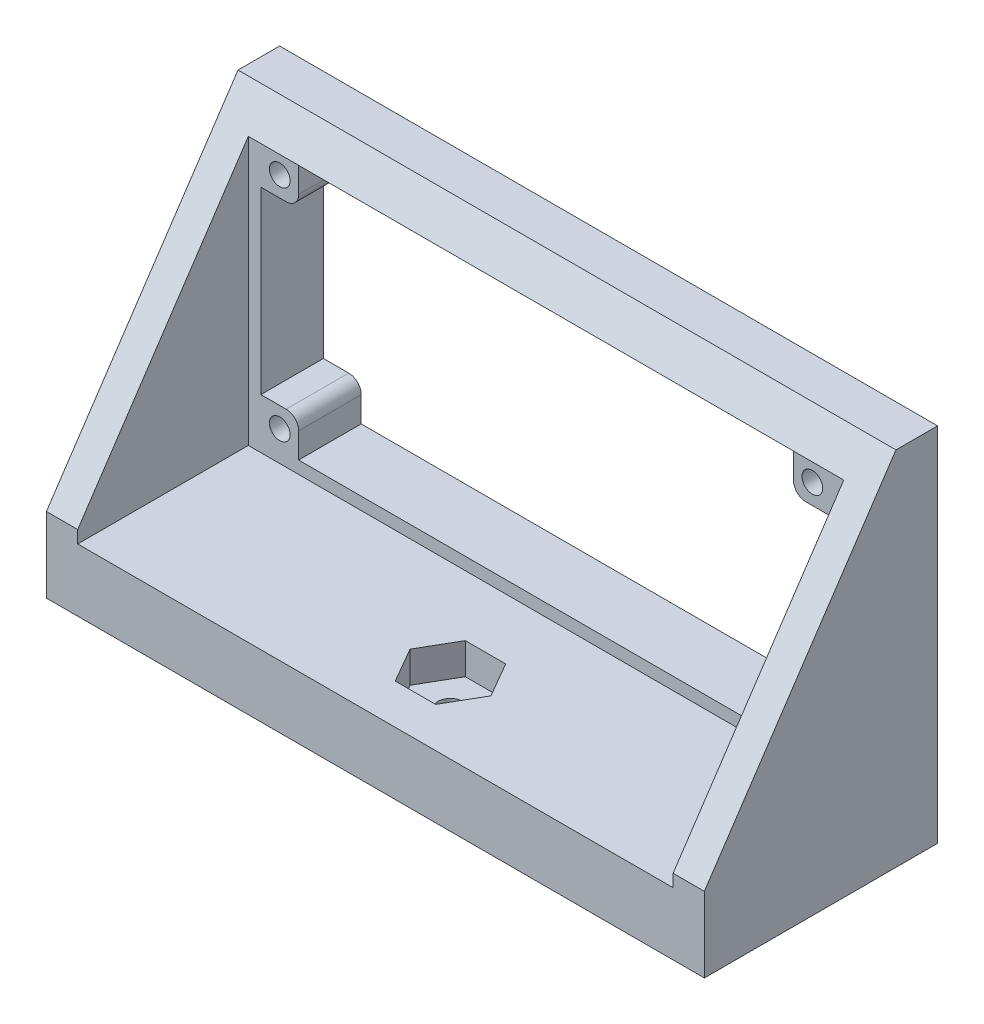
from build123d import *

# Parameters (mm, degrees)
ESQUISSE1_W             = 45.59
ESQUISSE1_H             = 20.4
ESQUISSE1_R             = 0.825
BOSS_EXTRU_1_DEPTH      = 5
ESQUISSE2_W             = 45.59
ESQUISSE2_H             = 18.64
BOSS_EXTRU_2_DEPTH      = 6
ESQUISSE3_R             = 1
ENL_V_MAT_EXTRU_1_DEPTH = 6
ENL_V_MAT_EXTRU_2_DEPTH = 3.5
ESQUISSE5_W             = 39.55
ESQUISSE5_H             = 20.4
ENL_V_MAT_EXTRU_3_DEPTH = 5
BOSS_EXTRU_3_DEPTH      = 3.5
BOSS_EXTRU_4_DEPTH      = 3.5
ESQUISSE8_W             = 45.59
ESQUISSE8_H             = 14.36
ENL_V_MAT_EXTRU_4_DEPTH = 5
ENL_V_MAT_EXTRU_5_DEPTH = 1
ENL_V_MAT_EXTRU_6_DEPTH = 1
ESQUISSE12_W            = 47.59
ESQUISSE12_H            = 13.64
ENL_V_MAT_EXTRU_7_DEPTH = 1
CONG_2_R                = 1
ESQUISSE13_W            = 52.59
ESQUISSE13_H            = 5
BOSS_EXTRU_5_DEPTH      = 2.5
ENL_V_MAT_EXTRU_8_DEPTH = 53.5


with BuildPart() as part:
    # Esquisse1 → Boss.-Extru.1 (new body)
    with BuildSketch(Plane.XY):
        Rectangle(ESQUISSE1_W, ESQUISSE1_H)
        with Locations((-21.285, 8.79)):
            Circle(ESQUISSE1_R, mode=Mode.SUBTRACT)
        with Locations((21.285, 8.79)):
            Circle(ESQUISSE1_R, mode=Mode.SUBTRACT)
        with Locations((21.285, -8.79)):
            Circle(ESQUISSE1_R, mode=Mode.SUBTRACT)
        with Locations((-21.285, -8.79)):
            Circle(ESQUISSE1_R, mode=Mode.SUBTRACT)
    extrude(amount=BOSS_EXTRU_1_DEPTH)

    # Esquisse2 → Boss.-Extru.2 (add)
    with BuildSketch(Plane.XZ.offset(10.2)):
        with Locations((0, 9.32)):
            Rectangle(ESQUISSE2_W, ESQUISSE2_H)
    extrude(amount=BOSS_EXTRU_2_DEPTH)

    # Esquisse3 → Enlèv. mat.-Extru.1 (cut)
    with BuildSketch(Plane(origin=(0, -10.2, 0), x_dir=(1, 0, 0), z_dir=(0, 1, 0))):
        with Locations((0, -12.64)):
            Circle(ESQUISSE3_R)
    extrude(amount=-ENL_V_MAT_EXTRU_1_DEPTH, mode=Mode.SUBTRACT)

    # Esquisse4 → Enlèv. mat.-Extru.2 (cut)
    with BuildSketch(Plane(origin=(0, -10.2, 0), x_dir=(1, 0, 0), z_dir=(0, 1, 0))):
        Polygon((1.616580754, -15.44), (3.233161507, -12.64), (1.616580754, -9.84), (-1.616580754, -9.84), (-3.233161507, -12.64), (-1.616580754, -15.44), align=None)
    extrude(amount=-ENL_V_MAT_EXTRU_2_DEPTH, mode=Mode.SUBTRACT)

    # Esquisse5 → Enlèv. mat.-Extru.3 (cut)
    with BuildSketch(Plane(origin=(0, 0, 0), x_dir=(-1, 0, 0), z_dir=(0, 0, -1))):
        Rectangle(ESQUISSE5_W, ESQUISSE5_H)
    extrude(amount=-ENL_V_MAT_EXTRU_3_DEPTH, mode=Mode.SUBTRACT)

    # Esquisse6 → Boss.-Extru.3 (add)
    with BuildSketch(Plane.ZY.offset(22.795)):
        Polygon((0, 10.2), (5, 10.2), (18.64, -10.2), (18.64, -16.2), (0, -16.2), align=None)
    extrude(amount=BOSS_EXTRU_3_DEPTH)

    # Esquisse7 → Boss.-Extru.4 (add)
    with BuildSketch(Plane(origin=(22.795, 0, 0), x_dir=(0, 0, -1), z_dir=(1, 0, 0))):
        Polygon((0, 10.2), (-5, 10.2), (-18.64, -10.2), (-18.64, -16.2), (0, -16.2), align=None)
    extrude(amount=BOSS_EXTRU_4_DEPTH)

    # Esquisse8 → Enlèv. mat.-Extru.4 (cut)
    with BuildSketch(Plane(origin=(0, 0, 0), x_dir=(-1, 0, 0), z_dir=(0, 0, -1))):
        Rectangle(ESQUISSE8_W, ESQUISSE8_H)
    extrude(amount=-ENL_V_MAT_EXTRU_4_DEPTH, mode=Mode.SUBTRACT)

    # Esquisse10 → Enlèv. mat.-Extru.5 (cut)
    with BuildSketch(Plane.ZY.offset(-22.795)):
        Polygon((5, 10.2), (18.64, -10.2), (5, -10.2), align=None)
    extrude(amount=-ENL_V_MAT_EXTRU_5_DEPTH, mode=Mode.SUBTRACT)

    # Esquisse11 → Enlèv. mat.-Extru.6 (cut)
    with BuildSketch(Plane(origin=(-22.795, 0, 0), x_dir=(0, 0, -1), z_dir=(1, 0, 0))):
        Polygon((-5, 10.2), (-18.64, -10.2), (-5, -10.2), align=None)
    extrude(amount=-ENL_V_MAT_EXTRU_6_DEPTH, mode=Mode.SUBTRACT)

    # Esquisse12 → Enlèv. mat.-Extru.7 (cut)
    with BuildSketch(Plane(origin=(0, -10.2, 0), x_dir=(1, 0, 0), z_dir=(0, 1, 0))):
        with Locations((0, -11.82)):
            Rectangle(ESQUISSE12_W, ESQUISSE12_H)
    extrude(amount=-ENL_V_MAT_EXTRU_7_DEPTH, mode=Mode.SUBTRACT)

    # Congé2
    cong_2_edges = [part.edges().sort_by_distance(p)[0] for p in [
        (19.775, 7.18, 2.5),
        (19.775, -7.18, 2.5),
        (-19.775, -7.18, 2.5),
        (-19.775, 7.18, 2.5),
    ]]
    fillet(cong_2_edges, radius=CONG_2_R)

    # Esquisse13 → Boss.-Extru.5 (add)
    with BuildSketch(Plane(origin=(0, 10.2, 0), x_dir=(1, 0, 0), z_dir=(0, 1, 0))):
        with Locations((0, -2.5)):
            Rectangle(ESQUISSE13_W, ESQUISSE13_H)
    extrude(amount=BOSS_EXTRU_5_DEPTH)

    # Esquisse14 → Enlèv. mat.-Extru.8 (cut)
    with BuildSketch(Plane.ZY.offset(26.295)):
        Polygon((5, 10.2), (2.5, 13.939002933), (5, 13.939002933), align=None)
    extrude(amount=-ENL_V_MAT_EXTRU_8_DEPTH, mode=Mode.SUBTRACT)


solid = part.part
